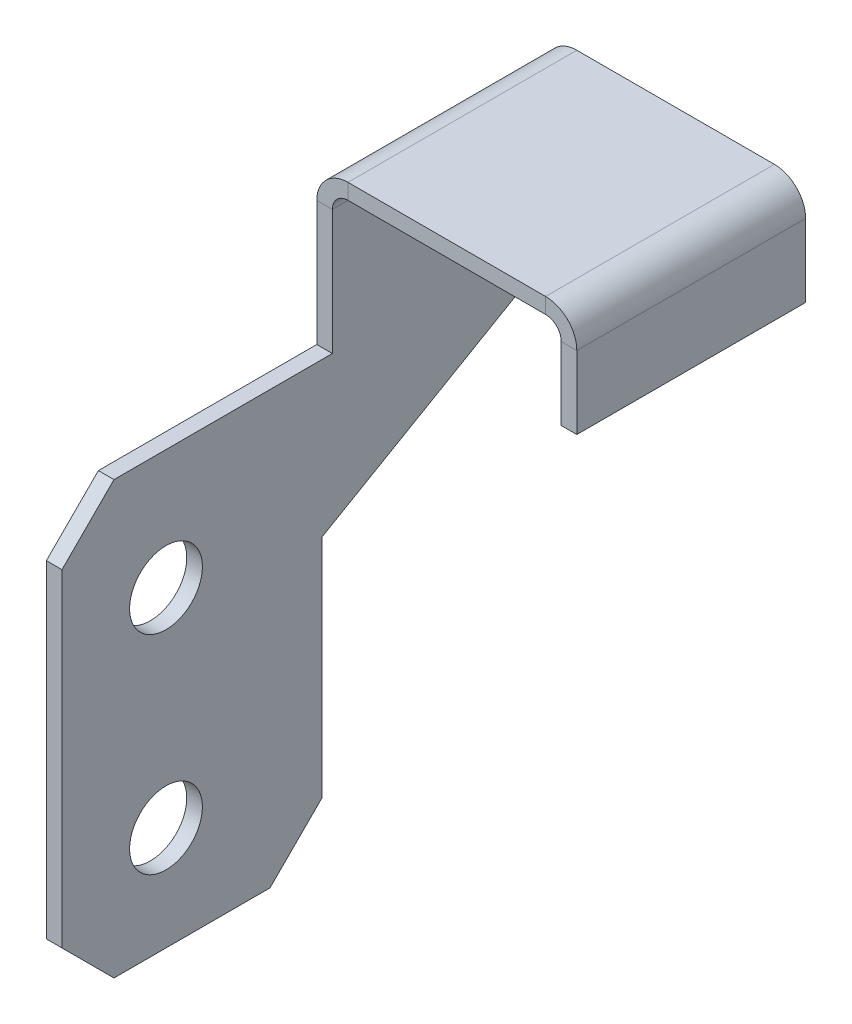
from build123d import *

# Parameters (mm, degrees)
SM_BASE_FLANGE_1_DEPTH = 48
CUT_EXTRUDE_1_DEPTH    = 10
SKETCH_10_R            = 3.5
CUT_EXTRUDE_2_DEPTH    = 10
SKETCH_11_W            = 30
SKETCH_11_H            = 26
CUT_EXTRUDE_3_DEPTH    = 15
OTHER_START            = 16.263455967
OTHER_1_OUTLINE_W      = 4
OTHER_1_OUTLINE_H      = 30.405591591
OTHER_1_DEPTH          = 3.535533906
OTHER_START_2          = 59.75052301
OTHER_1_2_OUTLINE_W    = 4
OTHER_1_2_OUTLINE_H    = 30.405591591
OTHER_1_2_DEPTH        = 3.535533906
OTHER_START_3          = 30.405591591
OTHER_1_3_OUTLINE_W    = 4
OTHER_1_3_OUTLINE_H    = 3.594408409
OTHER_1_3_DEPTH        = 7.071067812


# Read off the part's stored shape, not the designer's step: Затупленный угол1
# Sheet-metal steps are written as plain solids
with BuildPart() as part:
    # Sketch 2 → Базовая кромка1 (new body)
    with BuildSketch(Plane.XY):
        with BuildLine():
            Line((0, 0), (0, 53.5))
            ThreePointArc((0, 53.5), (0.878679656, 55.621320344), (3, 56.5))
            Line((3, 56.5), (22, 56.5))
            ThreePointArc((22, 56.5), (24.121320344, 55.621320344), (25, 53.5))
            Line((25, 53.5), (25, 46.5))
            Line((25, 46.5), (23.5, 46.5))
            Line((23.5, 46.5), (23.5, 53.5))
            ThreePointArc((23.5, 53.5), (23.060660172, 54.560660172), (22, 55))
            Line((22, 55), (3, 55))
            ThreePointArc((3, 55), (1.939339828, 54.560660172), (1.5, 53.5))
            Line((1.5, 53.5), (1.5, 0))
            Line((1.5, 0), (0, 0))
        make_face()
    extrude(amount=SM_BASE_FLANGE_1_DEPTH)

    # Эскиз7 → Вырез-Вытянуть1 (cut)
    with BuildSketch(Plane.ZY):
        Polygon((23, 0), (23, 26.720943809), (0, 40), (0, 0), align=None)
    extrude(amount=-CUT_EXTRUDE_1_DEPTH, mode=Mode.SUBTRACT)

    # Эскиз10 → Вырез-Вытянуть2 (cut)
    with BuildSketch(Plane.ZY):
        with Locations((38, 10)):
            Circle(SKETCH_10_R)
        with Locations((38, 30)):
            Circle(SKETCH_10_R)
    extrude(amount=-CUT_EXTRUDE_2_DEPTH, mode=Mode.SUBTRACT)

    # Эскиз11 → Вырез-Вытянуть3 (cut)
    with BuildSketch(Plane(origin=(0, 56.5, 0), x_dir=(1, 0, 0), z_dir=(0, 1, 0))):
        with Locations((11, -35)):
            Rectangle(SKETCH_11_W, SKETCH_11_H)
    extrude(amount=-CUT_EXTRUDE_3_DEPTH, mode=Mode.SUBTRACT)

    # Other 1 outline → Other 1 (cut)
    with BuildSketch(Plane(origin=(0, 0, 0), x_dir=(1, 0, 0), z_dir=(0, 0.707106781186547, 0.707106781186548)).offset(OTHER_START)):
        with Locations((1, -15.202795796)):
            Rectangle(OTHER_1_OUTLINE_W, OTHER_1_OUTLINE_H)
    extrude(amount=OTHER_1_DEPTH, mode=Mode.SUBTRACT)

    # Other 1 2 outline → Other 1 2 (cut)
    with BuildSketch(Plane(origin=(0, 0, 0), x_dir=(1, 0, 0), z_dir=(0, 0.707106781186547, 0.707106781186548)).offset(OTHER_START_2)):
        with Locations((1, -15.202795796)):
            Rectangle(OTHER_1_2_OUTLINE_W, OTHER_1_2_OUTLINE_H)
    extrude(amount=OTHER_1_2_DEPTH, mode=Mode.SUBTRACT)

    # Other 1 3 outline → Other 1 3 (cut)
    with BuildSketch(Plane(origin=(0, 0, 0), x_dir=(1, 0, 0), z_dir=(0, 0.707106781186547, 0.707106781186548)).offset(OTHER_START_3)):
        with Locations((1, -32.202795796)):
            Rectangle(OTHER_1_3_OUTLINE_W, OTHER_1_3_OUTLINE_H)
    extrude(amount=OTHER_1_3_DEPTH, mode=Mode.SUBTRACT)


solid = part.part
